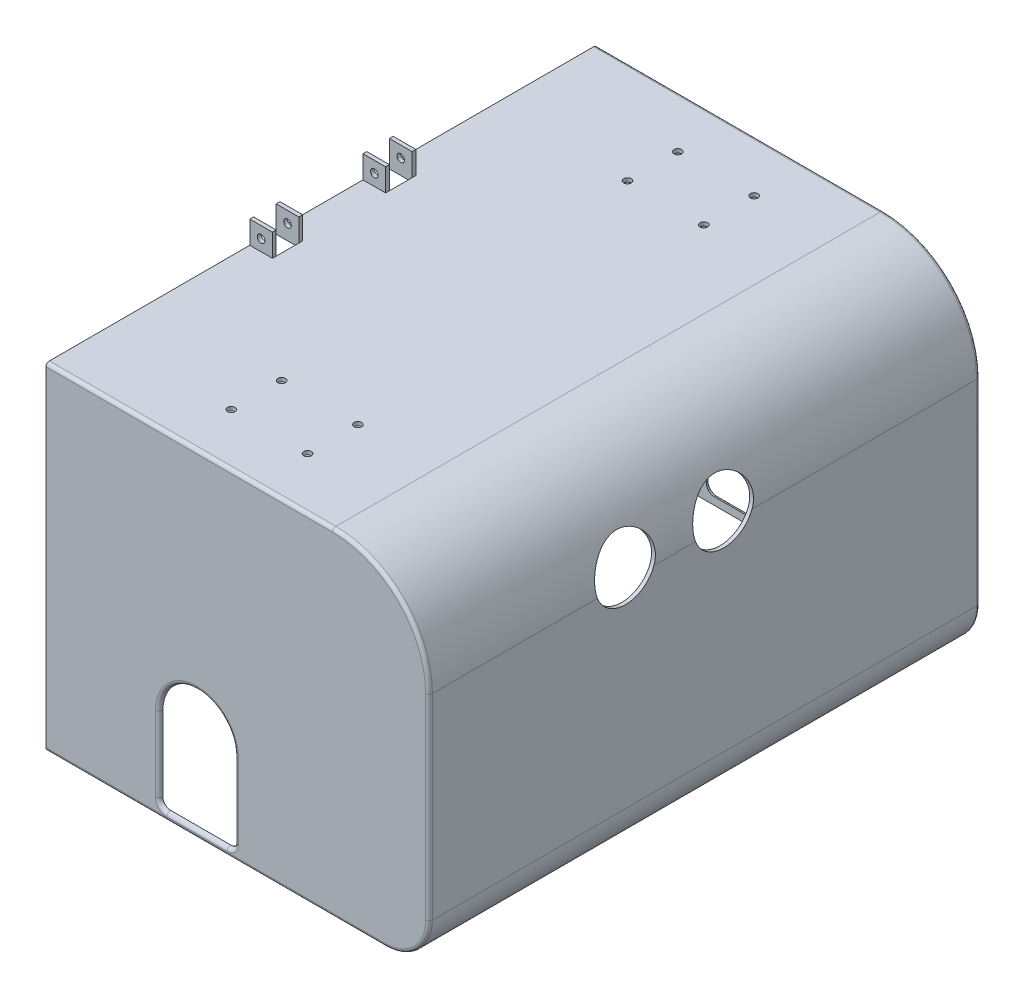
from build123d import *

# Parameters (mm, degrees)
CUT_EXTRUDE1_DEPTH      = 10
BOSS_EXTRUDE1_DEPTH     = 30
CUT_EXTRUDE2_DEPTH      = 752.943114111524
CUT_EXTRUDE2_DEPTH_BACK = 752.943114111524
SKETCH5_R               = 4.999999999999998
SKETCH6_R               = 40.00000000000003
CUT_EXTRUDE3_DEPTH      = 752.943114111524
BOSS_EXTRUDE3_DEPTH     = 5
CUT_EXTRUDE4_DEPTH      = 752.943114111524
CUT_EXTRUDE4_DEPTH_BACK = 752.943114111524
FILLET1_R               = 5
FILLET2_R               = 4.5
CUT_EXTRUDE5_REACH      = 769.798
SKETCH13_R              = 4.999999999999991
CUT_EXTRUDE6_REACH      = 787.596
SKETCH14_R              = 4.999999999999991
SKETCH14_R_2            = 4.999999999999939


with BuildPart() as part:
    # Sweep2: sweep along a path in Sketch1
    with BuildLine(Plane.XY) as sweep2_path:
        Line((0, 0), (379.6, 0))
        ThreePointArc((379.6, 0), (450.3106781186548, -29.289321881345245), (479.6, -99.99999999999997))
        Line((479.6, -99.99999999999997), (479.6, -360))
        ThreePointArc((479.6, -360), (470.81320343559645, -381.21320343559637), (449.6000000000001, -390))
        Line((449.6000000000001, -390), (370.00000000000006, -390))
    # Sketch2 → Sweep2 (sweep)
    with BuildSketch(Plane(origin=(0, 0, 0), x_dir=(0, 0, -1), z_dir=(1, 0, 0))):
        with BuildLine():
            Line((-360.49999999999994, 27.89826377546352), (360.50000000000006, 27.89826377546352))
            ThreePointArc((360.50000000000006, 27.89826377546352), (363.68198051533955, 26.580244290802984), (365.00000000000006, 23.39826377546352))
            Line((365.00000000000006, 23.39826377546352), (365.00000000000006, 22.89826377546352))
            Line((365.00000000000006, 22.89826377546352), (-364.99999999999994, 22.89826377546352))
            Line((-364.99999999999994, 22.89826377546352), (-364.99999999999994, 23.39826377546352))
            ThreePointArc((-364.99999999999994, 23.39826377546352), (-363.68198051533943, 26.580244290802984), (-360.49999999999994, 27.89826377546352))
        make_face()
    sweep(path=sweep2_path.line)

    # Sketch3 → Cut-Extrude1 (cut)
    with BuildSketch(Plane(origin=(0, 27.89826377546352, 0), x_dir=(1, 0, 0), z_dir=(0, 1, 0))):
        Polygon((-8.83e-15, 60), (30.00000000000002, 60), (30.00000000000002, 90.00000000000003), (-6.99e-15, 90.00000000000003), align=None)
        Polygon((-8.83e-15, -60), (30.00000000000002, -60), (30.00000000000002, -90.00000000000003), (-6.99e-15, -90.00000000000003), align=None)
    extrude(amount=-CUT_EXTRUDE1_DEPTH, mode=Mode.SUBTRACT)

    # Sketch4 → Boss-Extrude1 (add)
    with BuildSketch(Plane(origin=(0, 27.89826377546352, 0), x_dir=(1, 0, 0), z_dir=(0, 1, 0))):
        Polygon((0, -90.00000000000003), (30.00000000000002, -90.00000000000003), (30.00000000000002, -95.00000000000003), (6.1e-16, -95.00000000000003), align=None)
        Polygon((-8.83e-15, -60), (30.00000000000002, -60), (30.00000000000002, -54.99999999999999), (0, -54.99999999999999), align=None)
        Polygon((6.1e-16, 95.00000000000003), (30.00000000000002, 95.00000000000003), (30.00000000000002, 90.00000000000003), (0, 90.00000000000003), align=None)
        Polygon((0, 54.99999999999999), (30.00000000000002, 54.99999999999999), (30.00000000000002, 60), (-8.83e-15, 60), align=None)
    extrude(amount=BOSS_EXTRUDE1_DEPTH)

    # Sketch5 → Cut-Extrude2 (cut, two sides: drawn at the far end of the back side and taken through both)
    with BuildSketch(Plane.XY.offset(-CUT_EXTRUDE2_DEPTH_BACK)):
        with Locations((15.000000000000012, 42.89826377546352)):
            Circle(SKETCH5_R)
    extrude(amount=CUT_EXTRUDE2_DEPTH + CUT_EXTRUDE2_DEPTH_BACK, mode=Mode.SUBTRACT)

    # Sketch6 → Cut-Extrude3 (cut, through all)
    with BuildSketch(Plane(origin=(0, 0, 0), x_dir=(0, 0, -1), z_dir=(1, 0, 0))):
        with Locations(Location((-104.49999999999999, -85.90173622453648, 0), (0, 0, 200.637645216))):
            Circle(SKETCH6_R)
        with Locations(Location((25.50000000000002, -85.90173622453648, 0), (0, 0, 200.637645216))):
            Circle(SKETCH6_R)
    extrude(amount=CUT_EXTRUDE3_DEPTH, mode=Mode.SUBTRACT)

    # Sketch9 → Boss-Extrude3 (add)
    with BuildSketch(Plane(origin=(0, 0, -365.00000000000006), x_dir=(-1, 0, 0), z_dir=(0, 0, -1))):
        with BuildLine():
            Line((0, 22.898263775463516), (-379.6, 22.898263775463516))
            ThreePointArc((-379.6, 22.898263775463516), (-466.50219571168327, -13.097804288316723), (-502.49826377546356, -99.99999999999997))
            Line((-502.49826377546356, -99.99999999999997), (-502.49826377546356, -360))
            ThreePointArc((-502.49826377546356, -360), (-487.0047210286247, -397.4047210286247), (-449.6000000000001, -412.89826377546353))
            Line((-449.6000000000001, -412.89826377546353), (-370.00000000000006, -412.89826377546353))
            Line((-370.00000000000006, -412.89826377546353), (-370.00000000000006, -417.89826377546353))
            Line((-370.00000000000006, -417.89826377546353), (0, -417.89826377546353))
            Line((0, -417.89826377546353), (0, -412.89826377546353))
            Line((0, -412.89826377546353), (0, 22.898263775463516))
        make_face()
    boss_extrude3 = extrude(amount=-BOSS_EXTRUDE3_DEPTH)

    # Mirror3: Boss-Extrude3 across plane
    add(boss_extrude3.mirror(Plane.XY))

    # Sketch11 → Cut-Extrude4 (cut, two sides: drawn at the far end of the back side and taken through both)
    with BuildSketch(Plane.XY.offset(-CUT_EXTRUDE4_DEPTH_BACK)):
        with BuildLine():
            Line((149.99826377546347, -297.89826377546353), (149.99826377546347, -397.89826377546353))
            ThreePointArc((149.99826377546347, -397.89826377546353), (152.927195963598, -404.969331587329), (159.99826377546347, -407.8982637754636))
            Line((159.99826377546347, -407.8982637754636), (239.99826377546347, -407.8982637754636))
            ThreePointArc((239.99826377546347, -407.8982637754636), (247.06933158732897, -404.96933158732907), (249.99826377546347, -397.89826377546353))
            Line((249.99826377546347, -397.89826377546353), (249.99826377546347, -297.89826377546353))
            ThreePointArc((249.99826377546347, -297.89826377546353), (199.99826377546347, -247.89826377546353), (149.99826377546347, -297.89826377546353))
        make_face()
    extrude(amount=CUT_EXTRUDE4_DEPTH + CUT_EXTRUDE4_DEPTH_BACK, mode=Mode.SUBTRACT)

    # Fillet1
    fillet1_edges = [part.edges().sort_by_distance(p)[0] for p in [
        (247.06933158732897, -404.96933158732907, -365.00000000000006),
        (247.06933158732897, -404.96933158732907, 364.99999999999994),
        (199.99826377546344, -407.8982637754636, -365.00000000000006),
        (199.99826377546344, -407.8982637754636, 364.99999999999994),
        (152.927195963598, -404.969331587329, -365.00000000000006),
        (152.927195963598, -404.969331587329, 364.99999999999994),
        (149.99826377546347, -347.89826377546353, -365.00000000000006),
        (149.99826377546347, -347.89826377546353, 364.99999999999994),
        (199.99826377546347, -247.89826377546353, -365.00000000000006),
        (199.99826377546347, -247.89826377546353, 364.99999999999994),
        (249.99826377546347, -347.89826377546353, -365.00000000000006),
        (249.99826377546347, -347.89826377546353, 364.99999999999994),
    ]]
    fillet(fillet1_edges, radius=FILLET1_R - 0.0001)  # a hair under: the kernel refuses the full size

    # Fillet2
    fillet2_edges = [part.edges().sort_by_distance(p)[0] for p in [
        (185.00000000000003, -417.89826377546353, -365.00000000000006),
        (185.00000000000003, -417.89826377546353, 365.00000000000006),
    ]]
    fillet(fillet2_edges, radius=FILLET2_R)

    # Sketch13 → Cut-Extrude5 (cut, up to next)
    with BuildSketch(Plane(origin=(0, 27.89826377546352, 0), x_dir=(1, 0, 0), z_dir=(0, 1, 0)), mode=Mode.PRIVATE) as cut_extrude5_sk1:
        with Locations(Location((176.31641992134345, -229.13071131685336, 0), (0, 0, 270))):
            Circle(SKETCH13_R)
    cut_extrude5_tool1 = extrude(cut_extrude5_sk1.sketch, amount=-CUT_EXTRUDE5_REACH, mode=Mode.PRIVATE) & part.part
    # Sketch13 → Cut-Extrude5 (cut, up to next)
    with BuildSketch(Plane(origin=(0, 27.89826377546352, 0), x_dir=(1, 0, 0), z_dir=(0, 1, 0)), mode=Mode.PRIVATE) as cut_extrude5_sk2:
        with Locations(Location((277.4164199213434, -295.869288683147, 0), (0, 0, 270))):
            Circle(SKETCH13_R)
    cut_extrude5_tool2 = extrude(cut_extrude5_sk2.sketch, amount=-CUT_EXTRUDE5_REACH, mode=Mode.PRIVATE) & part.part
    # Sketch13 → Cut-Extrude5 (cut, up to next)
    with BuildSketch(Plane(origin=(0, 27.89826377546352, 0), x_dir=(1, 0, 0), z_dir=(0, 1, 0)), mode=Mode.PRIVATE) as cut_extrude5_sk3:
        with Locations(Location((277.4164199213434, -229.13071131685336, 0), (0, 0, 270))):
            Circle(SKETCH13_R)
    cut_extrude5_tool3 = extrude(cut_extrude5_sk3.sketch, amount=-CUT_EXTRUDE5_REACH, mode=Mode.PRIVATE) & part.part
    # Sketch13 → Cut-Extrude5 (cut, up to next)
    with BuildSketch(Plane(origin=(0, 27.89826377546352, 0), x_dir=(1, 0, 0), z_dir=(0, 1, 0)), mode=Mode.PRIVATE) as cut_extrude5_sk4:
        with Locations(Location((176.31641992134345, -295.869288683147, 0), (0, 0, 270))):
            Circle(SKETCH13_R)
    cut_extrude5_tool4 = extrude(cut_extrude5_sk4.sketch, amount=-CUT_EXTRUDE5_REACH, mode=Mode.PRIVATE) & part.part
    # Sketch13 → Cut-Extrude5 (cut, up to next)
    with BuildSketch(Plane(origin=(0, 27.89826377546352, 0), x_dir=(1, 0, 0), z_dir=(0, 1, 0)), mode=Mode.PRIVATE) as cut_extrude5_sk5:
        with Locations(Location((277.4164199213434, 229.13071131685336, 0), (0, 0, 270))):
            Circle(SKETCH13_R)
    cut_extrude5_tool5 = extrude(cut_extrude5_sk5.sketch, amount=-CUT_EXTRUDE5_REACH, mode=Mode.PRIVATE) & part.part
    # Sketch13 → Cut-Extrude5 (cut, up to next)
    with BuildSketch(Plane(origin=(0, 27.89826377546352, 0), x_dir=(1, 0, 0), z_dir=(0, 1, 0)), mode=Mode.PRIVATE) as cut_extrude5_sk6:
        with Locations(Location((176.31641992134345, 229.13071131685336, 0), (0, 0, 270))):
            Circle(SKETCH13_R)
    cut_extrude5_tool6 = extrude(cut_extrude5_sk6.sketch, amount=-CUT_EXTRUDE5_REACH, mode=Mode.PRIVATE) & part.part
    # Sketch13 → Cut-Extrude5 (cut, up to next)
    with BuildSketch(Plane(origin=(0, 27.89826377546352, 0), x_dir=(1, 0, 0), z_dir=(0, 1, 0)), mode=Mode.PRIVATE) as cut_extrude5_sk7:
        with Locations(Location((176.31641992134345, 295.869288683147, 0), (0, 0, 270))):
            Circle(SKETCH13_R)
    cut_extrude5_tool7 = extrude(cut_extrude5_sk7.sketch, amount=-CUT_EXTRUDE5_REACH, mode=Mode.PRIVATE) & part.part
    # Sketch13 → Cut-Extrude5 (cut, up to next)
    with BuildSketch(Plane(origin=(0, 27.89826377546352, 0), x_dir=(1, 0, 0), z_dir=(0, 1, 0)), mode=Mode.PRIVATE) as cut_extrude5_sk8:
        with Locations(Location((277.4164199213434, 295.869288683147, 0), (0, 0, 270))):
            Circle(SKETCH13_R)
    cut_extrude5_tool8 = extrude(cut_extrude5_sk8.sketch, amount=-CUT_EXTRUDE5_REACH, mode=Mode.PRIVATE) & part.part
    add(cut_extrude5_tool1.solids().sort_by_distance((176.31642, 27.898264, 229.130711))[0], mode=Mode.SUBTRACT)
    add(cut_extrude5_tool2.solids().sort_by_distance((277.41642, 27.898264, 295.869289))[0], mode=Mode.SUBTRACT)
    add(cut_extrude5_tool3.solids().sort_by_distance((277.41642, 27.898264, 229.130711))[0], mode=Mode.SUBTRACT)
    add(cut_extrude5_tool4.solids().sort_by_distance((176.31642, 27.898264, 295.869289))[0], mode=Mode.SUBTRACT)
    add(cut_extrude5_tool5.solids().sort_by_distance((277.41642, 27.898264, -229.130711))[0], mode=Mode.SUBTRACT)
    add(cut_extrude5_tool6.solids().sort_by_distance((176.31642, 27.898264, -229.130711))[0], mode=Mode.SUBTRACT)
    add(cut_extrude5_tool7.solids().sort_by_distance((176.31642, 27.898264, -295.869289))[0], mode=Mode.SUBTRACT)
    add(cut_extrude5_tool8.solids().sort_by_distance((277.41642, 27.898264, -295.869289))[0], mode=Mode.SUBTRACT)

    # Sketch14 → Cut-Extrude6 (cut, up to next)
    with BuildSketch(Plane.XZ.offset(417.89826377546353), mode=Mode.PRIVATE) as cut_extrude6_sk1:
        with Locations(Location((390.00000000000006, 99.99999999999999, 0), (0, 0, 270))):
            Circle(SKETCH14_R)
    cut_extrude6_tool1 = extrude(cut_extrude6_sk1.sketch, amount=-CUT_EXTRUDE6_REACH, mode=Mode.PRIVATE) & part.part
    # Sketch14 → Cut-Extrude6 (cut, up to next)
    with BuildSketch(Plane.XZ.offset(417.89826377546353), mode=Mode.PRIVATE) as cut_extrude6_sk2:
        with Locations(Location((390.0000000000002, -100.00000000000018, 0), (0, 0, 90))):
            Circle(SKETCH14_R_2)
    cut_extrude6_tool2 = extrude(cut_extrude6_sk2.sketch, amount=-CUT_EXTRUDE6_REACH, mode=Mode.PRIVATE) & part.part
    add(cut_extrude6_tool1.solids().sort_by_distance((390, -417.898264, 100))[0], mode=Mode.SUBTRACT)
    add(cut_extrude6_tool2.solids().sort_by_distance((390, -417.898264, -100))[0], mode=Mode.SUBTRACT)


solid = part.part
